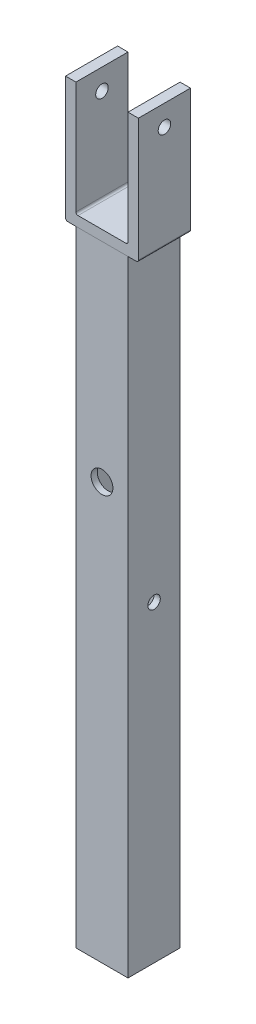
from build123d import *

# Parameters (mm, degrees)
SKETCH1_W           = 25
SKETCH1_H           = 25
SKETCH1_W_2         = 19
SKETCH1_H_2         = 19
BOSS_EXTRUDE1_DEPTH = 300
SKETCH2_R           = 7.5
CUT_EXTRUDE1_DEPTH  = 3
SKETCH3_R           = 5.25
CUT_EXTRUDE2_DEPTH  = 3
SKETCH4_R           = 3
CUT_EXTRUDE3_DEPTH  = 25
SKETCH5_W           = 35
SKETCH5_H           = 25
BOSS_EXTRUDE2_DEPTH = 60
SKETCH7_W           = 25
SKETCH7_H           = 25
CUT_EXTRUDE4_DEPTH  = 55
SKETCH8_R           = 3
CUT_EXTRUDE5_DEPTH  = 55
FILLET1_R           = 1
FILLET2_R           = 1


with BuildPart() as part:
    # Sketch1 → Boss-Extrude1 (new body)
    with BuildSketch(Plane(origin=(0, 0, 0), x_dir=(1, 0, 0), z_dir=(0, 1, 0))):
        Rectangle(SKETCH1_W, SKETCH1_H)
        Rectangle(SKETCH1_W_2, SKETCH1_H_2, mode=Mode.SUBTRACT)
    extrude(amount=BOSS_EXTRUDE1_DEPTH)

    # Sketch2 → Cut-Extrude1 (cut)
    with BuildSketch(Plane(origin=(0, 0, -12.5), x_dir=(-1, 0, 0), z_dir=(0, 0, -1))):
        with Locations((0, 200)):
            Circle(SKETCH2_R)
    extrude(amount=-CUT_EXTRUDE1_DEPTH, mode=Mode.SUBTRACT)

    # Sketch3 → Cut-Extrude2 (cut)
    with BuildSketch(Plane.XY.offset(12.5)):
        with Locations((0, 200)):
            Circle(SKETCH3_R)
    extrude(amount=-CUT_EXTRUDE2_DEPTH, mode=Mode.SUBTRACT)

    # Sketch4 → Cut-Extrude3 (cut)
    with BuildSketch(Plane(origin=(12.5, 0, 0), x_dir=(0, 0, -1), z_dir=(1, 0, 0))):
        with Locations((0, 150)):
            Circle(SKETCH4_R)
    extrude(amount=-CUT_EXTRUDE3_DEPTH, mode=Mode.SUBTRACT)


with BuildPart() as body_2:
    # Sketch5 → Boss-Extrude2 (new body)
    with BuildSketch(Plane(origin=(0, 300, 0), x_dir=(1, 0, 0), z_dir=(0, 1, 0))):
        Rectangle(SKETCH5_W, SKETCH5_H)
    extrude(amount=BOSS_EXTRUDE2_DEPTH)

    # Sketch7 → Cut-Extrude4 (cut)
    with BuildSketch(Plane(origin=(0, 360, 0), x_dir=(1, 0, 0), z_dir=(0, 1, 0))):
        Rectangle(SKETCH7_W, SKETCH7_H)
    extrude(amount=-CUT_EXTRUDE4_DEPTH, mode=Mode.SUBTRACT)

    # Sketch8 → Cut-Extrude5 (cut)
    with BuildSketch(Plane.ZY.offset(17.5)):
        with Locations((0, 350)):
            Circle(SKETCH8_R)
    extrude(amount=-CUT_EXTRUDE5_DEPTH, mode=Mode.SUBTRACT)

    # Fillet1
    fillet1_edges = [body_2.edges().sort_by_distance(p)[0] for p in [
        (12.5, 305, 0),
        (-12.5, 305, 0),
    ]]
    fillet(fillet1_edges, radius=FILLET1_R)

    # Fillet2
    fillet2_edges = [body_2.edges().sort_by_distance(p)[0] for p in [
        (17.5, 300, 0),
        (-17.5, 300, 0),
    ]]
    fillet(fillet2_edges, radius=FILLET2_R)


solid = Compound([part.part, body_2.part])
